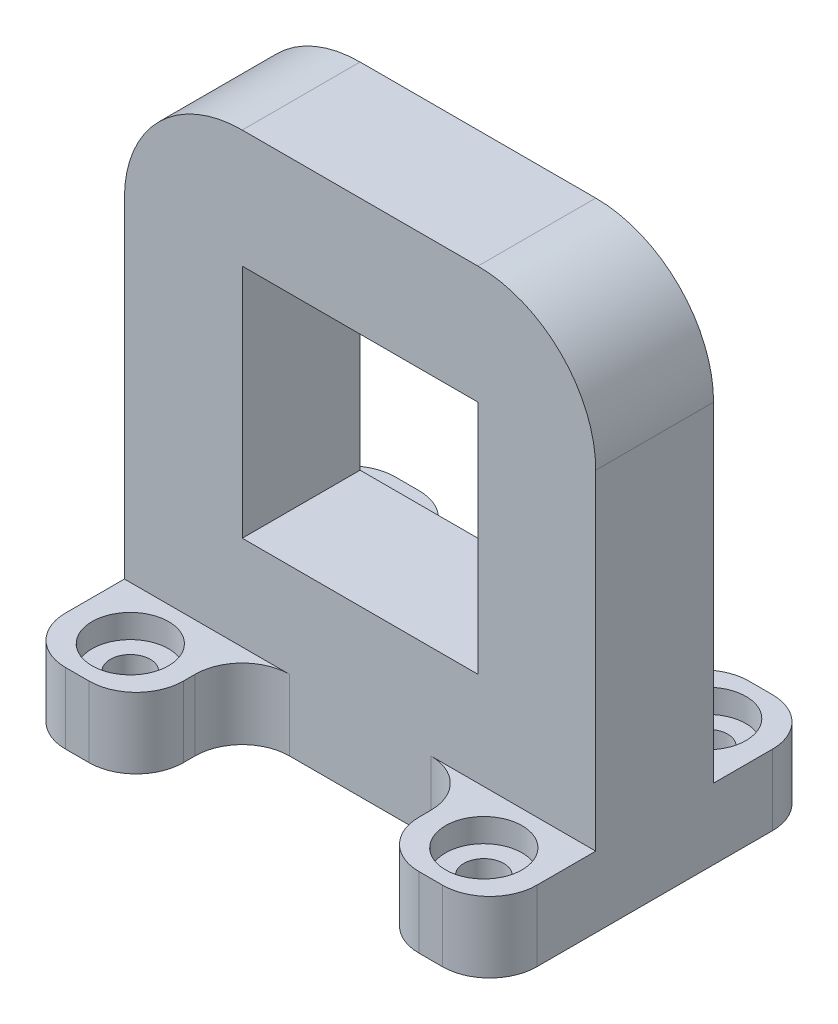
from build123d import *

# Parameters (mm, degrees)
ESQUISSE1_W                                          = 40
ESQUISSE1_H                                          = 44
ESQUISSE1_W_2                                        = 20
ESQUISSE1_H_2                                        = 20
BOSS_EXTRU_1_DEPTH                                   = 10
ESQUISSE3_W                                          = 10
ESQUISSE3_H                                          = 6
BOSS_EXTRU_2_DEPTH                                   = 9
CHAMBRAGE_POUR_T_TE_CYLINDRIQUE_FENDUE_M_D           = 3.4
CHAMBRAGE_POUR_T_TE_CYLINDRIQUE_FENDUE_M_CBORE_D     = 6.5
CHAMBRAGE_POUR_T_TE_CYLINDRIQUE_FENDUE_M_CBORE_DEPTH = 2
CONG_1_R                                             = 4
CONG_2_R                                             = 10


with BuildPart() as part:
    # Esquisse1 → Boss.-Extru.1 (new body)
    with BuildSketch(Plane.XY):
        with Locations((20, 22)):
            Rectangle(ESQUISSE1_W, ESQUISSE1_H)
        with Locations((20, 24)):
            Rectangle(ESQUISSE1_W_2, ESQUISSE1_H_2, mode=Mode.SUBTRACT)
    extrude(amount=BOSS_EXTRU_1_DEPTH)

    # Esquisse3 → Boss.-Extru.2 (add)
    with BuildSketch(Plane.XY.offset(10)):
        with Locations((35, 3)):
            Rectangle(ESQUISSE3_W, ESQUISSE3_H)
        with Locations((5, 3)):
            Rectangle(ESQUISSE3_W, ESQUISSE3_H)
    boss_extru_2 = extrude(amount=BOSS_EXTRU_2_DEPTH)

    # Chambrage pour tête cylindrique fendue M31 (through all)
    with Locations(Plane(origin=(0, 6, 0), x_dir=(1, 0, 0), z_dir=(0, 1, 0))):
        with Locations((5, -14.5), (35, -14.5)):
            chambrage_pour_t_te_cylindrique_fendue_m = CounterBoreHole(CHAMBRAGE_POUR_T_TE_CYLINDRIQUE_FENDUE_M_D / 2, CHAMBRAGE_POUR_T_TE_CYLINDRIQUE_FENDUE_M_CBORE_D / 2, CHAMBRAGE_POUR_T_TE_CYLINDRIQUE_FENDUE_M_CBORE_DEPTH)

    # Symétrie1: Boss.-Extru.2, Chambrage pour tête cylindrique fendue M31 across plane
    add(boss_extru_2.mirror(Plane.XY.offset(5)))
    add(chambrage_pour_t_te_cylindrique_fendue_m.mirror(Plane.XY.offset(5)), mode=Mode.SUBTRACT)

    # Congé1
    cong_1_edges = [part.edges().sort_by_distance(p)[0] for p in [
        (40, 3, 19),
        (30, 3, 19),
        (0, 3, 19),
        (10, 3, 19),
        (30, 3, 10),
        (10, 3, 10),
        (0, 3, -9),
        (10, 3, -9),
        (10, 3, 0),
        (30, 3, 0),
        (30, 3, -9),
        (40, 3, -9),
    ]]
    fillet(cong_1_edges, radius=CONG_1_R)

    # Congé2
    cong_2_edges = [part.edges().sort_by_distance(p)[0] for p in [
        (0, 44, 5),
        (40, 44, 5),
    ]]
    fillet(cong_2_edges, radius=CONG_2_R)


solid = part.part
